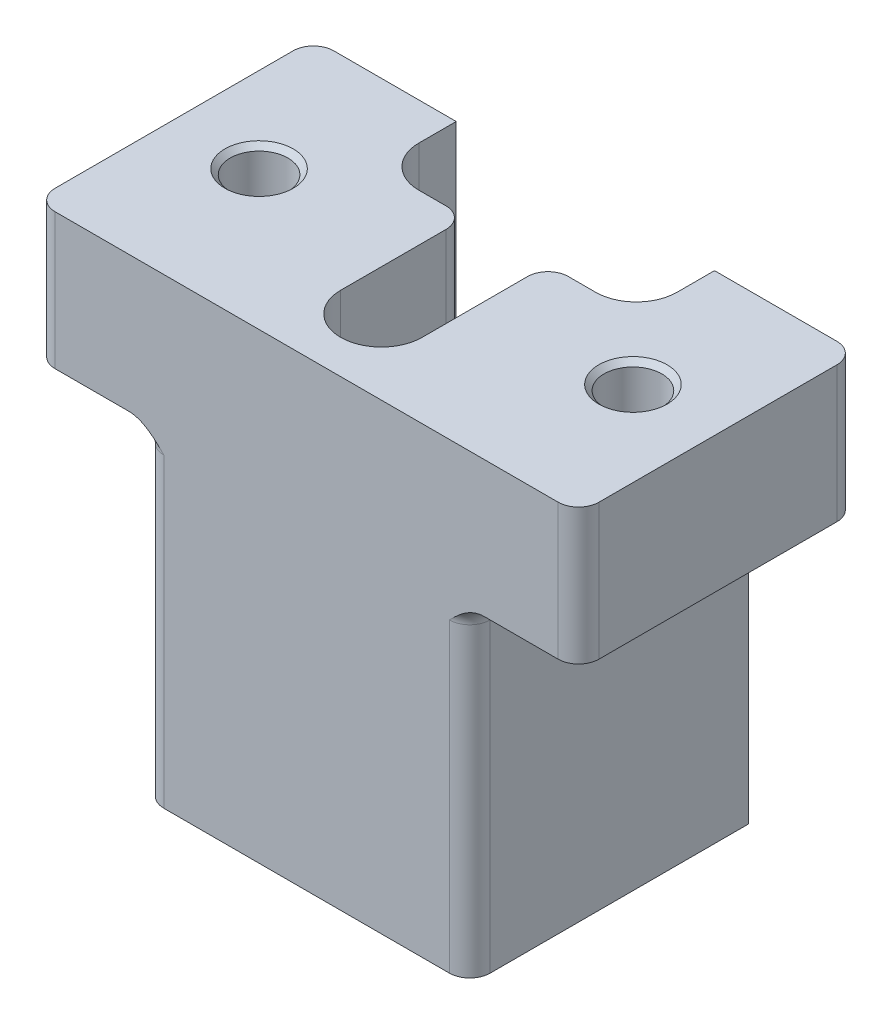
from build123d import *

# Parameters (mm, degrees)
SKETCH2_W                    = 80
SKETCH2_H                    = 41
BOSS_EXTRUDE1_DEPTH          = 68
FILLET1_R                    = 3
SKETCH5_OUTSIDE_W            = 104.544
SKETCH5_OUTSIDE_H            = 65.544
CUT_EXTRUDE2_DEPTH           = 48
CUT_EXTRUDE3_DEPTH           = 82.672987579
FILLET2_R                    = 3
FILLET3_R                    = 3
M10_TAPPED_HOLE1_D           = 8.5
M10_TAPPED_HOLE1_DEPTH       = 16.946342369
M10_TAPPED_HOLE1_CSINK_D     = 10.05
M10_TAPPED_HOLE1_CSINK_ANGLE = 90
M10_TAPPED_HOLE1_TIP         = 2.553657631


with BuildPart() as part:
    # Sketch2 → Boss-Extrude1 (new body)
    with BuildSketch(Plane(origin=(0, 0, 0), x_dir=(1, 0, 0), z_dir=(0, 1, 0))):
        with Locations((0, -0.63)):
            Rectangle(SKETCH2_W, SKETCH2_H)
    extrude(amount=-BOSS_EXTRUDE1_DEPTH)

    # Fillet1
    fillet1_edges = [part.edges().sort_by_distance(p)[0] for p in [
        (40, -34, 21.13),
        (-40, -34, 21.13),
        (-40, -34, -19.87),
        (40, -34, -19.87),
    ]]
    fillet(fillet1_edges, radius=FILLET1_R)

    # Sketch5 outside → Cut-Extrude2 (cut)
    with BuildSketch(Plane.XZ.offset(68)):
        with Locations((0, 0.63)):
            Rectangle(SKETCH5_OUTSIDE_W, SKETCH5_OUTSIDE_H)
        with BuildLine():
            Line((19, -19.87), (24, -19.87))
            Line((24, -19.87), (24, 21.13))
            Line((24, 21.13), (-24, 21.13))
            Line((-24, 21.13), (-24, -19.87))
            Line((-24, -19.87), (-19, -19.87))
            Line((-19, -19.87), (-19, -14.37))
            ThreePointArc((-19, -14.37), (-17.242640687, -10.127359313), (-13, -8.37))
            Line((-13, -8.37), (-9, -8.37))
            ThreePointArc((-9, -8.37), (-6.878679656, -7.491320344), (-6, -5.37))
            Line((-6, -5.37), (-6, 10.13))
            ThreePointArc((-6, 10.13), (0, 16.13), (6, 10.13))
            Line((6, 10.13), (6, -5.37))
            ThreePointArc((6, -5.37), (6.878679656, -7.491320344), (9, -8.37))
            Line((9, -8.37), (13, -8.37))
            ThreePointArc((13, -8.37), (17.242640687, -10.127359313), (19, -14.37))
            Line((19, -14.37), (19, -19.87))
        make_face(mode=Mode.SUBTRACT)
    extrude(amount=-CUT_EXTRUDE2_DEPTH, mode=Mode.SUBTRACT)

    # Sketch6 → Cut-Extrude3 (cut, through all)
    with BuildSketch(Plane.XZ.offset(68)):
        with BuildLine():
            Line((-13, -8.37), (-9, -8.37))
            ThreePointArc((-9, -8.37), (-6.878679656, -7.491320344), (-6, -5.37))
            Line((-6, -5.37), (-6, 10.13))
            ThreePointArc((-6, 10.13), (0, 16.13), (6, 10.13))
            Line((6, 10.13), (6, -5.37))
            ThreePointArc((6, -5.37), (6.878679656, -7.491320344), (9, -8.37))
            Line((9, -8.37), (13, -8.37))
            ThreePointArc((13, -8.37), (17.242640687, -10.127359313), (19, -14.37))
            Line((19, -14.37), (19, -19.87))
            Line((19, -19.87), (-19, -19.87))
            Line((-19, -19.87), (-19, -14.37))
            ThreePointArc((-19, -14.37), (-17.242640687, -10.127359313), (-13, -8.37))
        make_face()
    extrude(amount=-CUT_EXTRUDE3_DEPTH, mode=Mode.SUBTRACT)

    # Fillet2
    fillet2_edges = [part.edges().sort_by_distance(p)[0] for p in [
        (24, -44, 21.13),
        (-24, -44, 21.13),
    ]]
    fillet(fillet2_edges, radius=FILLET2_R)

    # Fillet3
    # the kernel refuses this fillet: 3 mm, written as the material it adds along each edge
    with BuildSketch(Plane(origin=(24, -20, -19.87), x_dir=(0, -1, 0), z_dir=(0, 0, 1)), Plane(origin=(-24, -20, 18.13), x_dir=(0, -1, 0), z_dir=(0, 0, -1))) as fillet3_piece_1:
        with BuildLine():
            CenterArc((FILLET3_R, FILLET3_R), FILLET3_R, 180, 90)
            Line((0, FILLET3_R), (0, 0))
            Line((0, 0), (FILLET3_R, 0))
        make_face()
    extrude(amount=38)
    with BuildSketch(Plane(origin=(-21, -20, 18.13), x_dir=(0.5976672776328279, 0, -0.801744239297648), z_dir=(-0.801744239297648, 0, -0.5976672776328279))) as fillet3_piece_2_section:
        with BuildLine():
            CenterArc((3 + FILLET3_R, FILLET3_R), FILLET3_R, 180, 90)
            Line((3 + FILLET3_R, 0), (3, 0))
            Line((3, 0), (3, FILLET3_R))
        make_face()
    fillet3_piece_2 = revolve(axis=Axis((-21, -20, 18.13), (0, -1, 0)), revolution_arc=233.296989237, mode=Mode.PRIVATE)
    fillet3_piece_2 = split(fillet3_piece_2, bisect_by=Plane(origin=(-23.249816778, -20.934885373, 21.13), z_dir=(0, 0, -1)), keep=Keep.TOP, mode=Mode.PRIVATE)
    add(fillet3_piece_2)
    with BuildSketch(Plane(origin=(21, -20, 18.13), x_dir=(-0.5976672776328279, 0, -0.801744239297648), z_dir=(0.801744239297648, 0, -0.5976672776328279))) as fillet3_piece_3_section:
        with BuildLine():
            CenterArc((3 + FILLET3_R, -FILLET3_R), FILLET3_R, 90, 90)
            Line((3, -FILLET3_R), (3, 0))
            Line((3, 0), (3 + FILLET3_R, 0))
        make_face()
    fillet3_piece_3 = revolve(axis=Axis((21, -20, 18.13), (0, 1, 0)), revolution_arc=233.296989237, mode=Mode.PRIVATE)
    fillet3_piece_3 = split(fillet3_piece_3, bisect_by=Plane(origin=(23.249816872, -20.934884795, 21.13), z_dir=(0, 0, -1)), keep=Keep.TOP, mode=Mode.PRIVATE)
    add(fillet3_piece_3)

    # M10 Tapped Hole1
    with Locations(Plane(origin=(0, 0, 0), x_dir=(1, 0, 0), z_dir=(0, 1, 0))):
        with Locations((27.5, -0.63), (-27.5, -0.63)):
            CounterSinkHole(M10_TAPPED_HOLE1_D / 2, M10_TAPPED_HOLE1_CSINK_D / 2, depth=M10_TAPPED_HOLE1_DEPTH, counter_sink_angle=M10_TAPPED_HOLE1_CSINK_ANGLE)
            with Locations((0, 0, -(M10_TAPPED_HOLE1_DEPTH + M10_TAPPED_HOLE1_TIP / 2))):  # 118° drill point
                Cone(0, M10_TAPPED_HOLE1_D / 2, M10_TAPPED_HOLE1_TIP, mode=Mode.SUBTRACT)


solid = part.part
